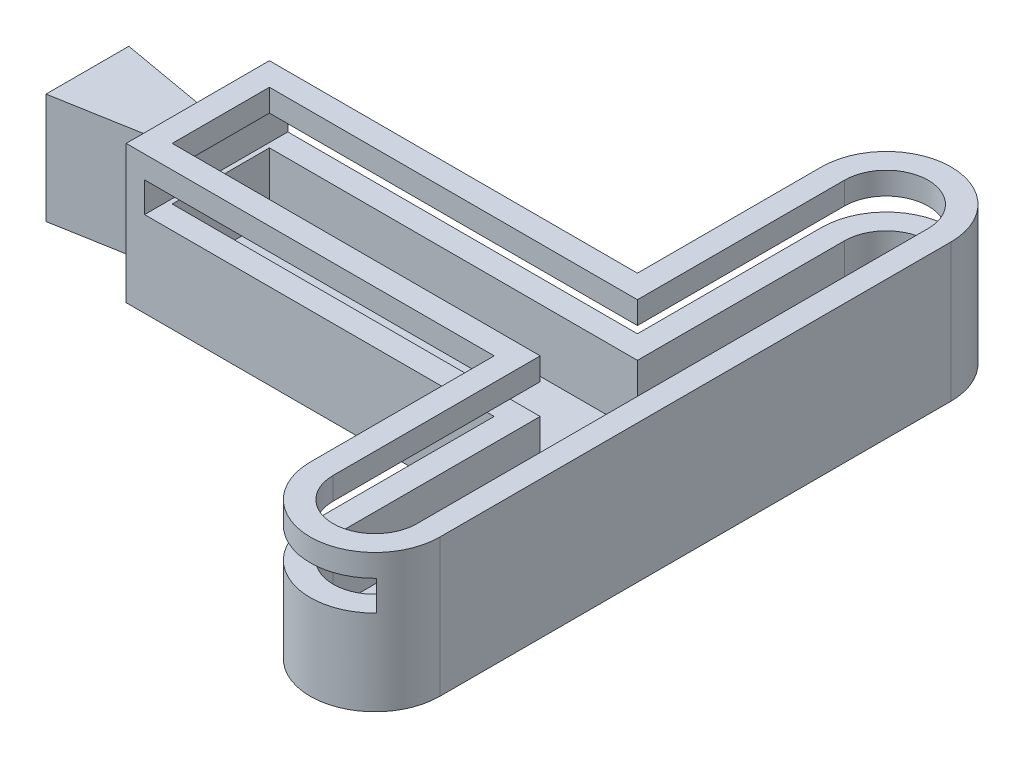
from build123d import *

# Parameters (mm, degrees)
BOSS_EXTRUDE1_DEPTH      = 38.1
CUT_EXTRUDE10_DEPTH      = 7.62
SHELL2_START             = 6.35
SHELL2_DEPTH             = 31.75
SHELL2_2_DEPTH           = 17.78
CUT_EXTRUDE11_DEPTH      = 204.366887563
CUT_EXTRUDE11_DEPTH_BACK = 204.366887563
SKETCH6_W                = 127.254
SKETCH6_H                = 8.308241082


# Read off the part's stored shape, not the designer's step: Shell2
with BuildPart() as part:
    # Sketch1 → Boss-Extrude1 (new body)
    with BuildSketch(Plane(origin=(0, 0, 0), x_dir=(1, 0, 0), z_dir=(0, 1, 0))):
        with BuildLine():
            Line((0, 11.43), (0, -11.43))
            Line((0, -11.43), (30.48, -6.055553628))
            Line((30.48, -6.055553628), (30.48, -19.771553628))
            Line((30.48, -19.771553628), (132.08, -19.771553628))
            Line((132.08, -19.771553628), (132.08, -70.571553628))
            ThreePointArc((132.08, -70.571553628), (149.987, -88.478553628), (167.894, -70.571553628))
            Line((167.894, -70.571553628), (167.894, 70.571553628))
            ThreePointArc((167.894, 70.571553628), (149.987, 88.478553628), (132.08, 70.571553628))
            Line((132.08, 70.571553628), (132.08, 19.771553628))
            Line((132.08, 19.771553628), (30.48, 19.771553628))
            Line((30.48, 19.771553628), (30.48, 6.055553628))
            Line((30.48, 6.055553628), (0, 11.43))
        make_face()
    extrude(amount=BOSS_EXTRUDE1_DEPTH)

    # Sketch5 → Cut-Extrude10 (cut)
    with BuildSketch(Plane(origin=(0, 38.1, 0), x_dir=(1, 0, 0), z_dir=(0, 1, 0))):
        Polygon((0, -11.43), (0, 11.43), (0.205611809, 11.576348711), (30.48, 6.055553628), (30.48, -6.055553628), align=None)
    extrude(amount=-CUT_EXTRUDE10_DEPTH, mode=Mode.SUBTRACT)

    # Shell2 outline → Shell2 (cut)
    with BuildSketch(Plane(origin=(0, 0, 0), x_dir=(1, 0, 0), z_dir=(0, 1, 0)).offset(SHELL2_START)):
        with BuildLine():
            Line((36.83, 13.421553628), (36.83, -13.421553628))
            Line((36.83, -13.421553628), (138.43, -13.421553628))
            Line((138.43, -13.421553628), (138.43, -70.571553628))
            ThreePointArc((138.43, -70.571553628), (149.987, -82.128553628), (161.544, -70.571553628))
            Line((161.544, -70.571553628), (161.544, 70.571553628))
            ThreePointArc((161.544, 70.571553628), (149.987, 82.128553628), (138.43, 70.571553628))
            Line((138.43, 70.571553628), (138.43, 13.421553628))
            Line((138.43, 13.421553628), (36.83, 13.421553628))
        make_face()
    extrude(amount=SHELL2_DEPTH, mode=Mode.SUBTRACT)

    # Shell2 2 outline → Shell2 2 (cut)
    with BuildSketch(Plane(origin=(0, 0, 0), x_dir=(1, 0, 0), z_dir=(0, 1, 0)).offset(SHELL2_START)):
        Polygon((28.25455863, 0), (6.35, 3.862364687), (6.35, -3.862364687), align=None)
    extrude(amount=SHELL2_2_DEPTH, mode=Mode.SUBTRACT)

    # Sketch6 → Cut-Extrude11 (cut, two sides: drawn at the far end of the back side and taken through both)
    with BuildSketch(Plane.XY.offset(19.771553628).offset(-CUT_EXTRUDE11_DEPTH_BACK)):
        with Locations((99.187, 27.763521135)):
            Rectangle(SKETCH6_W, SKETCH6_H)
    extrude(amount=CUT_EXTRUDE11_DEPTH + CUT_EXTRUDE11_DEPTH_BACK, mode=Mode.SUBTRACT)


solid = part.part
